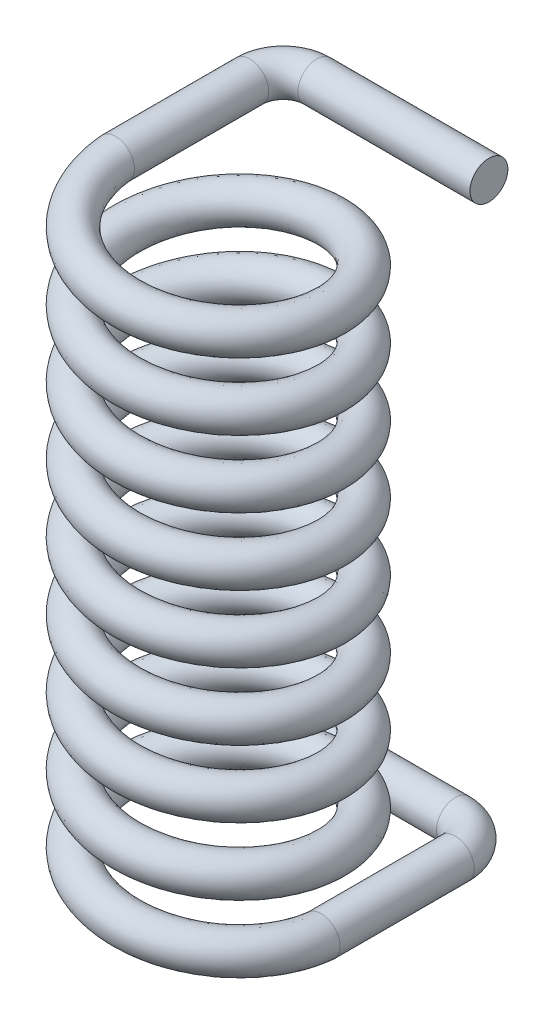
from build123d import *

# Parameters (mm, degrees)
SWEEP1_PITCH       = 4
SWEEP1_HEIGHT      = 34
SWEEP1_RADIUS      = 6.13
SWEEP1_START_ANGLE = 90
SKETCH1_R          = 1.13
SKETCH1_3_R        = 1.13
SWEEP3_OUTLINE_R   = 1.13
SWEEP3_ANGLE       = 90
SWEEP3_START       = -8.0000001
SWEEP3_2_OUTLINE_R = 1.13
SWEEP3_2_DEPTH     = 8.0000001
SWEEP3_START_2     = -4.1300001
SWEEP3_3_OUTLINE_R = 1.13
SWEEP3_3_DEPTH     = 10.2600001


with BuildPart() as part:
    # Sweep1: sweep along a helix
    with BuildLine() as sweep1_path:
        add(Helix(SWEEP1_PITCH, SWEEP1_HEIGHT, SWEEP1_RADIUS, center=(0, 0, 0), direction=(0, 1, 0), lefthand=True, mode=Mode.PRIVATE).rotate(Axis((0, 0, 0), (0, 1, 0)), SWEEP1_START_ANGLE))
    # Sketch1 → Sweep1 (sweep)
    with BuildSketch(Plane.XY):
        with Locations((6.13, 0)):
            Circle(SKETCH1_R)
    sweep(path=sweep1_path.line, is_frenet=True)

    # Sweep2: sweep along a path in Sketch3
    with BuildLine(Plane(origin=(0, 0, 0), x_dir=(1, 0, 0), z_dir=(0, 1, 0))) as sweep2_path:
        Line((6.13, 0), (6.13, 8))
        ThreePointArc((6.13, 8), (5.544213562, 9.414213562), (4.13, 10))
        Line((4.13, 10), (-6.13, 10))
    # Sketch1<3> → Sweep2 (sweep)
    with BuildSketch(Plane.XY):
        with Locations((6.13, 0)):
            Circle(SKETCH1_3_R)
    sweep(path=sweep2_path.line)



with BuildPart() as body_2:
    # Sweep3: read off the stored shape, not the designer's step
    # Sweep3 outline → Sweep3 (revolve)
    with BuildSketch(Plane(origin=(-4.13, 0, -8), x_dir=(0, 0, -1), z_dir=(1, 0, 0))):
        with Locations((2, 34)):
            Circle(SWEEP3_OUTLINE_R)
    revolve(axis=Axis((-4.13, 0, -8), (0, 1, 0)), revolution_arc=SWEEP3_ANGLE)


with BuildPart() as part_1:
    add(part.part)

    add(body_2.part)  # Sweep3 2 merges body 2
    # Sweep3 2 outline → Sweep3 2 (add)
    with BuildSketch(Plane.XY.offset(SWEEP3_START)):
        with Locations((-6.13, 34)):
            Circle(SWEEP3_2_OUTLINE_R)
    extrude(amount=SWEEP3_2_DEPTH)

    # Sweep3 3 outline → Sweep3 3 (add)
    with BuildSketch(Plane.YZ.offset(SWEEP3_START_2)):
        with Locations((34, -10)):
            Circle(SWEEP3_3_OUTLINE_R)
    extrude(amount=SWEEP3_3_DEPTH)


solid = part_1.part
